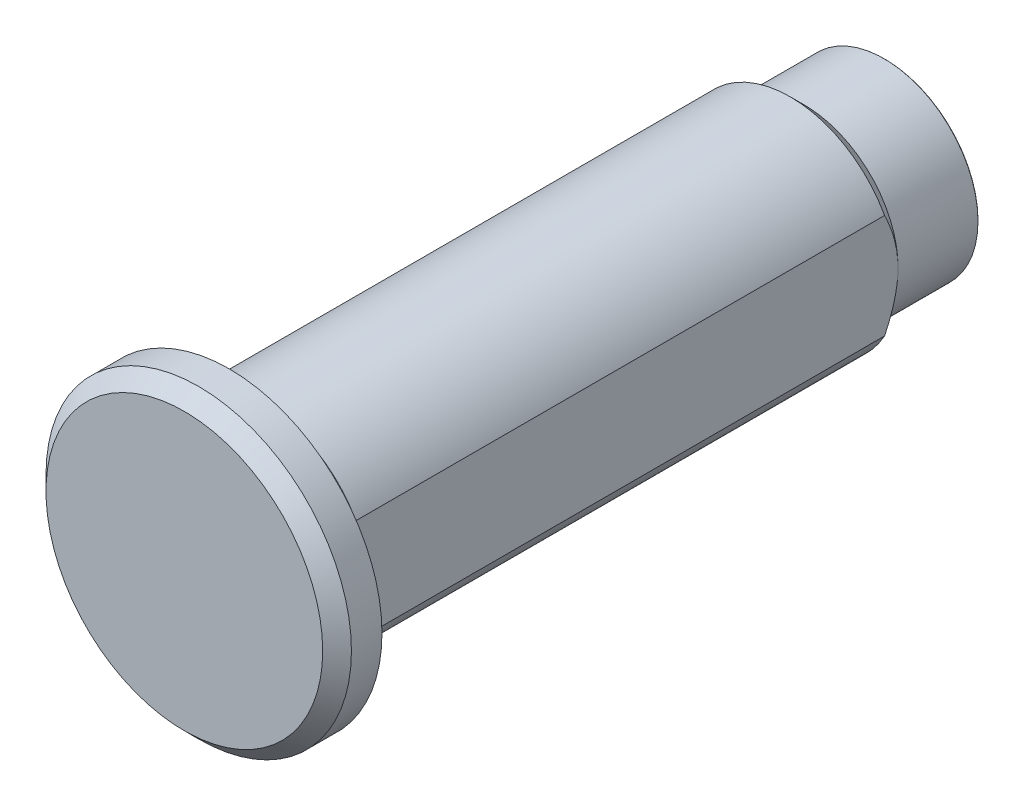
from build123d import *

# Parameters (mm, degrees)
BOSS_EXTRUDE1_START       = 4.524999897
BOSS_EXTRUDE1_2_OUTLINE_R = 5.225
BOSS_EXTRUDE1_2_DEPTH     = 30.925000207
SKETCH2_R                 = 8.5
BOSS_EXTRUDE2_DEPTH       = 2.5
SKETCH3_R                 = 7.8
SKETCH3_R_2               = 6
CUT_EXTRUDE1_DEPTH        = 1.15
SKETCH4_R                 = 5.225
BOSS_EXTRUDE3_DEPTH       = 4.5
CHAMFER1_SIZE             = 0.05
CHAMFER2_SIZE             = 0.799999999
CHAMFER2_SIZE2            = 0.800000001
FILLET1_R                 = 0.2


with BuildPart() as part:
    # Boss-Extrude1: read off the stored shape, not the designer's step
    # Boss-Extrude1 outline → Boss-Extrude1 (revolve)
    with BuildSketch(Plane.XZ):
        Polygon((5.225, 4.499999999), (5.225, 35.475000001), (5.2, 35.500000001), (5.2, 36.5), (0, 36.5), (0, 4.499999999), align=None)
    revolve(axis=Axis((0, 0, 0), (0, 0, 1)))

    # Boss-Extrude1 2 outline → Boss-Extrude1 2 (add)
    with BuildSketch(Plane.XY.offset(BOSS_EXTRUDE1_START)):
        with BuildLine():
            ThreePointArc((5.25, 2.904737509), (0, 6), (-5.25, 2.904737509))
            Line((-5.25, 2.904737509), (-5.25, -2.90473751))
            ThreePointArc((-5.25, -2.90473751), (0, -6), (5.25, -2.90473751))
            Line((5.25, -2.90473751), (5.25, 2.904737509))
        make_face()
        Circle(BOSS_EXTRUDE1_2_OUTLINE_R, mode=Mode.SUBTRACT)
    extrude(amount=BOSS_EXTRUDE1_2_DEPTH)

    # Boss-Extrude1 3 outline → Boss-Extrude1 3 (revolve, cut)
    with BuildSketch(Plane.XZ):
        Polygon((6, 5.275000001), (5.249999898, 4.524999897), (6, 4.524999897), align=None)
        Polygon((5.249999897, 35.450000104), (6, 34.699999999), (6, 35.450000104), align=None)
    revolve(axis=Axis((0, 0, 0), (0, 0, 1)), mode=Mode.SUBTRACT)

    # Boss-Extrude1 4 outline → Boss-Extrude1 4 (revolve)
    with BuildSketch(Plane.XZ):
        Polygon((5.225, 4.524999897), (5.225, 4.499999999), (5.249999898, 4.524999897), align=None)
        Polygon((5.225, 35.450000104), (5.249999897, 35.450000104), (5.225, 35.475000001), align=None)
    revolve(axis=Axis((0, 0, 0), (0, 0, 1)))

    # Sketch2 → Boss-Extrude2 (add)
    with BuildSketch(Plane(origin=(0, 0, 36.5), x_dir=(-1, 0, 0), z_dir=(0, 0, -1))):
        with Locations(Location((0, 0, 0), (0, 0, 180))):
            Circle(SKETCH2_R)
    extrude(amount=-BOSS_EXTRUDE2_DEPTH)

    # Sketch3 → Cut-Extrude1 (cut)
    with BuildSketch(Plane(origin=(0, 0, 36.5), x_dir=(-1, 0, 0), z_dir=(0, 0, -1))):
        with Locations(Location((0, 0, 0), (0, 0, 180))):
            Circle(SKETCH3_R)
        with Locations(Location((0, 0, 0), (0, 0, 180))):
            Circle(SKETCH3_R_2, mode=Mode.SUBTRACT)
    extrude(amount=-CUT_EXTRUDE1_DEPTH, mode=Mode.SUBTRACT)

    # Sketch4 → Boss-Extrude3 (add)
    with BuildSketch(Plane(origin=(0, 0, 4.5), x_dir=(-1, 0, 0), z_dir=(0, 0, -1))):
        Circle(SKETCH4_R)
    extrude(amount=BOSS_EXTRUDE3_DEPTH)

    # Chamfer1
    chamfer1_edges = [part.edges().sort_by_distance(p)[0] for p in [
        (5.225, 0, 0),
    ]]
    chamfer(chamfer1_edges, length=CHAMFER1_SIZE)

    # Chamfer2
    chamfer2_edges = [part.edges().sort_by_distance(p)[0] for p in [
        (-8.5, 0, 39),
    ]]
    chamfer2_side = [part.faces().sort_by_distance(p)[0] for p in [
        (-8.5, 0, 37.75),
    ]]
    chamfer(chamfer2_edges, length=CHAMFER2_SIZE, length2=CHAMFER2_SIZE2, reference=chamfer2_side[0])

    # Fillet1
    fillet1_edges = [part.edges().sort_by_distance(p)[0] for p in [
        (-7.8, 0, 37.65),
        (-6, 0, 37.65),
    ]]
    fillet(fillet1_edges, radius=FILLET1_R)


solid = part.part
